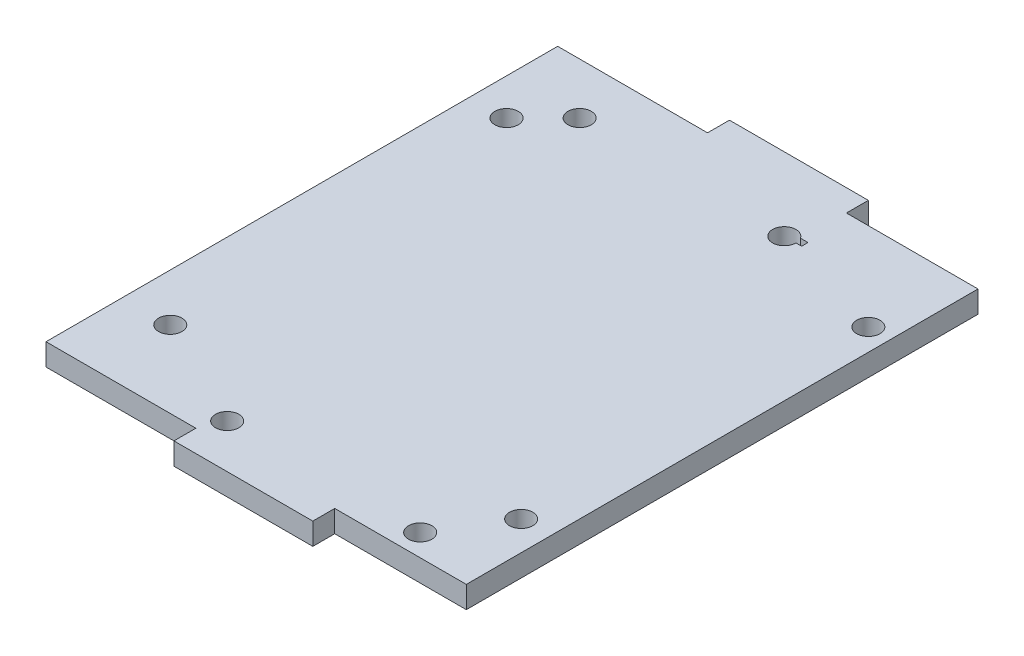
from build123d import *

# Parameters (mm, degrees)
SKETCH1_R           = 1.6
BOSS_EXTRUDE1_DEPTH = 3
SKETCH3_R           = 1.6
CUT_EXTRUDE1_DEPTH  = 10


with BuildPart() as part:
    # Sketch1 → Boss-Extrude1 (new body)
    with BuildSketch(Plane(origin=(0, 0, 0), x_dir=(1, 0, 0), z_dir=(0, 1, 0))):
        Polygon((61, -35), (63.79786164, -35), (63.79786164, 35), (61, 35), (45.79786164, 35), (45.79786164, 38), (26.79786164, 38), (26.79786164, 35), (8.79786164, 35), (6.29786164, 35), (6.29786164, -35), (8.79786164, -35), (26.79786164, -35), (26.79786164, -38), (45.79786164, -38), (45.79786164, -35), align=None)
        with Locations((12.79786164, -24.5)):
            Circle(SKETCH1_R, mode=Mode.SUBTRACT)
        with Locations((59.79786164, -23.5)):
            Circle(SKETCH1_R, mode=Mode.SUBTRACT)
        with Locations((16.29786164, 28)):
            Circle(SKETCH1_R, mode=Mode.SUBTRACT)
        with BuildLine():
            Line((46.668055556, 28), (45.89786164, 28))
            ThreePointArc((45.89786164, 28), (42.764338, 27.543595307), (45.637480085, 28.874884233))
            Line((45.637480085, 28.874884233), (46.668055556, 28.874884233))
            Line((46.668055556, 28.874884233), (46.668055556, 28))
        make_face(mode=Mode.SUBTRACT)
    extrude(amount=BOSS_EXTRUDE1_DEPTH)

    # Sketch3 → Cut-Extrude1 (cut)
    with BuildSketch(Plane.XZ):
        with Locations((11.29786164, -23)):
            Circle(SKETCH3_R)
        with Locations((60.79786164, -23)):
            Circle(SKETCH3_R)
        with Locations((54.48786164, 32)):
            Circle(SKETCH3_R)
        with Locations((28.08786164, 32)):
            Circle(SKETCH3_R)
    extrude(amount=-CUT_EXTRUDE1_DEPTH, mode=Mode.SUBTRACT)


solid = part.part
